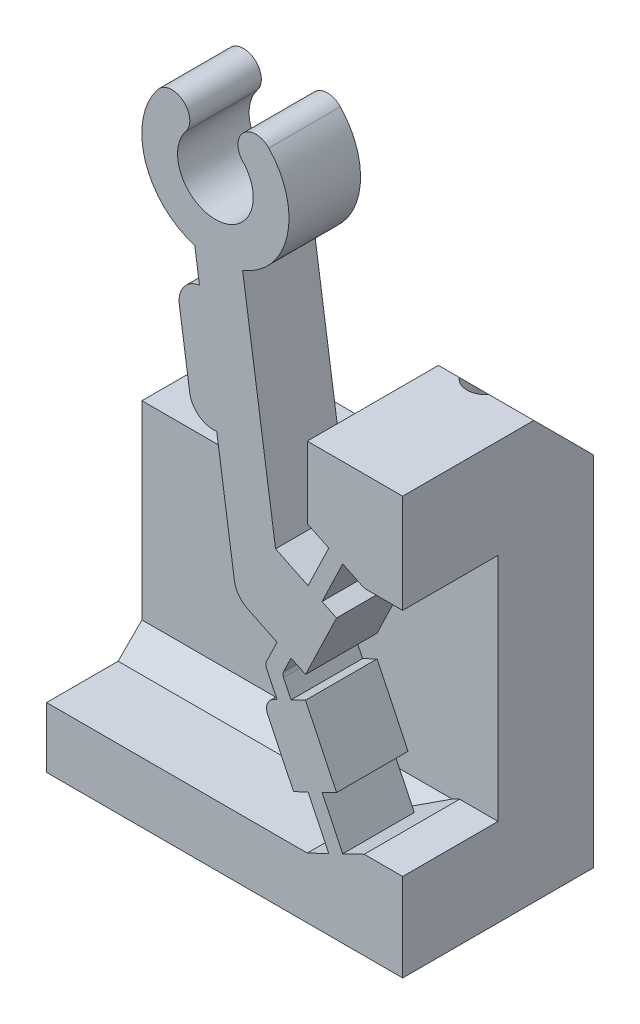
from build123d import *

# Parameters (mm, degrees)
BOSS_SWITCH_BODY_DEPTH        = 3
SKETCH1_W                     = 4
SKETCH1_H                     = 3.687347025
SKETCH1_H_2                   = 4.149321045
BOSS_FLANGE_WIDTH_DEPTH       = 5
BOSS_FLANGE_HEIGHT_REACH      = 35.973
SKETCH2_W                     = 4
SKETCH2_H                     = 4.149321045
SKETCH2_W_2                   = 8
SKETCH2_H_2                   = 2.53802598
SKETCH17_W                    = 14.933333866
SKETCH17_H                    = 4
BOSS_FLANGE_SUPPORT_DEPTH     = 10.812652975
CUT_WALL_GAP_DEPTH            = 1
SKETCH26_W                    = 10.933333866
SKETCH26_H                    = 6
CUT_CAM_SLOPE_CLEARANCE_DEPTH = 31.059873248
TAP_DRILL_FOR_M2X0_4_TAP1_D   = 1.6
M2_CLEARANCE_HOLE2_D          = 2.4
M2_CLEARANCE_HOLE2_DEPTH      = 6.5
CHAMFER_FLANGE_SUPPORT_3_SIZE = 1
SKETCH25_W                    = 5.60571229
SKETCH25_H                    = 17.5
CUT_BASE_REMOVAL_DEPTH        = 3
CHAMFER8_SIZE                 = 2.5
FILLET1_R                     = 1
FILLET2_R                     = 0.5


with BuildPart() as part:
    # Sketch-SwitchBossUp → Boss-Switch Body (new body)
    with BuildSketch(Plane.XY):
        with BuildLine():
            Line((-0.897289862, 21.27382814), (-0.700379438, 19.929528492))
            ThreePointArc((-0.700379438, 19.929528492), (-1.357570909, 19.537245674), (-1.544889614, 18.795155289))
            Line((-1.544889614, 18.795155289), (-1.110095072, 15.826830221))
            ThreePointArc((-1.110095072, 15.826830221), (-0.717812255, 15.169638751), (0.02427813, 14.982320046))
            Line((0.02427813, 14.982320046), (0.840131285, 9.412522958))
            Line((0.840131285, 9.412522958), (1.945259485, 8.880589721))
            Line((1.945259485, 8.880589721), (2.553471215, 8.587838134))
            Line((2.553471215, 8.587838134), (2.104108424, 7.654255765))
            ThreePointArc((2.104108424, 7.654255765), (2.079372028, 7.545829251), (2.104108424, 7.437402737))
            Line((2.104108424, 7.437402737), (2.553471215, 6.503820369))
            Line((2.553471215, 6.503820369), (1.945259485, 6.211068782))
            Line((1.945259485, 6.211068782), (3.246377649, 3.507905538))
            Line((3.246377649, 3.507905538), (3.854589379, 3.800657125))
            Line((3.854589379, 3.800657125), (4.722001489, 1.998548296))
            Line((4.722001489, 1.998548296), (3.820947074, 1.564842241))
            Line((3.820947074, 1.564842241), (3.820947074, -0.973183739))
            Line((3.820947074, -0.973183739), (5.277352178, -0.973183739))
            Line((5.277352178, -0.973183739), (13.426659364, -0.973183739))
            Line((13.426659364, -0.973183739), (13.426659364, 16.526816261))
            Line((13.426659364, 16.526816261), (7.114618425, 16.526816261))
            Line((7.114618425, 16.526816261), (3.820947074, 16.526816261))
            Line((3.820947074, 16.526816261), (3.820947074, 13.526816261))
            Line((3.820947074, 13.526816261), (4.722001489, 13.093110206))
            Line((4.722001489, 13.093110206), (3.854589379, 11.291001377))
            Line((3.854589379, 11.291001377), (2.490115752, 11.94776579))
            Line((2.490115752, 11.94776579), (1.110059725, 21.369353491))
            ThreePointArc((1.110059725, 21.369353491), (2.982945849, 23.574065074), (2.208754741, 26.361372687))
            ThreePointArc((2.208754741, 26.361372687), (1.148478545, 26.389910192), (1.119941041, 25.329633996))
            ThreePointArc((1.119941041, 25.329633996), (0.033089246, 22.651561394), (-1.270789677, 25.230944933))
            ThreePointArc((-1.270789677, 25.230944933), (-1.386617314, 26.285261754), (-2.440934135, 26.169434117))
            ThreePointArc((-2.440934135, 26.169434117), (-2.976976555, 23.309245483), (-0.897289862, 21.27382814))
        make_face()
        with BuildLine():
            Line((6.208741273, 2.714163286), (10.695012416, 2.714163286))
            Line((10.695012416, 2.714163286), (10.695012416, 12.377495216))
            Line((10.695012416, 12.377495216), (6.208741273, 12.377495216))
            Line((6.208741273, 12.377495216), (5.307686858, 12.811201271))
            Line((5.307686858, 12.811201271), (4.440274749, 11.009092442))
            Line((4.440274749, 11.009092442), (5.048486478, 10.716340855))
            Line((5.048486478, 10.716340855), (3.747368314, 8.013177611))
            Line((3.747368314, 8.013177611), (3.139156584, 8.305929198))
            Line((3.139156584, 8.305929198), (2.825485502, 7.654255765))
            ThreePointArc((2.825485502, 7.654255765), (2.800749105, 7.545829251), (2.825485502, 7.437402737))
            Line((2.825485502, 7.437402737), (3.139156584, 6.785729304))
            Line((3.139156584, 6.785729304), (3.747368314, 7.078480891))
            Line((3.747368314, 7.078480891), (5.048486478, 4.375317648))
            Line((5.048486478, 4.375317648), (4.440274749, 4.082566061))
            Line((4.440274749, 4.082566061), (5.307686858, 2.280457231))
            Line((5.307686858, 2.280457231), (6.208741273, 2.714163286))
        make_face(mode=Mode.SUBTRACT)
    extrude(amount=BOSS_SWITCH_BODY_DEPTH)

    # Sketch1 → Boss-Flange Width (add)
    with BuildSketch(Plane(origin=(0, 0, 0), x_dir=(-1, 0, 0), z_dir=(0, 0, -1))):
        with Locations((-5.820947074, 0.870489774)):
            Rectangle(SKETCH1_W, SKETCH1_H)
        with Locations((-5.820947074, 14.452155739)):
            Rectangle(SKETCH1_W, SKETCH1_H_2)
    extrude(amount=BOSS_FLANGE_WIDTH_DEPTH)

    # Sketch2 → Boss-Flange Height (add, up to next)
    with BuildSketch(Plane(origin=(-7.112386792, 0, 0), x_dir=(0, 0, -1), z_dir=(1, 0, 0)), mode=Mode.PRIVATE) as boss_flange_height_sk1:
        with Locations((3, 14.452155739)):
            Rectangle(SKETCH2_W, SKETCH2_H)
    boss_flange_height_tool1 = extrude(boss_flange_height_sk1.sketch, amount=BOSS_FLANGE_HEIGHT_REACH, mode=Mode.PRIVATE) - part.part
    # Sketch2 → Boss-Flange Height (add, up to next)
    with BuildSketch(Plane(origin=(-7.112386792, 0, 0), x_dir=(0, 0, -1), z_dir=(1, 0, 0)), mode=Mode.PRIVATE) as boss_flange_height_sk2:
        with Locations((1, 0.295829251)):
            Rectangle(SKETCH2_W_2, SKETCH2_H_2)
    boss_flange_height_tool2 = extrude(boss_flange_height_sk2.sketch, amount=BOSS_FLANGE_HEIGHT_REACH, mode=Mode.PRIVATE) - part.part
    add(boss_flange_height_tool1.solids().sort_by_distance((-7.112387, 14.452156, -3))[0])
    add(boss_flange_height_tool2.solids().sort_by_distance((-7.112387, 0.295829, -1))[0])

    # Sketch17 → Boss-Flange Support (add)
    with BuildSketch(Plane.XZ.offset(-1.564842241)):
        with Locations((0.354280141, -3)):
            Rectangle(SKETCH17_W, SKETCH17_H)
    extrude(amount=-BOSS_FLANGE_SUPPORT_DEPTH)

    # Sketch27 → Cut-Wall Gap (cut)
    with BuildSketch(Plane.XY):
        Polygon((3.820947074, 13.526816261), (6.208741273, 12.377495216), (3.820947074, 12.377495216), align=None)
        Polygon((6.208741273, 2.714163286), (3.820947074, 2.714163286), (3.820947074, 1.564842241), align=None)
    extrude(amount=-CUT_WALL_GAP_DEPTH, mode=Mode.SUBTRACT)

    # Sketch26 → Cut-Cam Slope Clearance (cut, through all)
    with BuildSketch(Plane.XY.offset(-1)):
        with Locations((-1.645719859, 13.526816261)):
            Rectangle(SKETCH26_W, SKETCH26_H)
    extrude(amount=-CUT_CAM_SLOPE_CLEARANCE_DEPTH, mode=Mode.SUBTRACT)

    # Tap Drill for M2x0.4 Tap1 (through all)
    with Locations(Plane(origin=(0, -0.973183739, 0), x_dir=(-1, 0, 0), z_dir=(0, -1, 0))):
        with Locations((4.112386792, 3), (-5.320947074, 3)):
            Hole(TAP_DRILL_FOR_M2X0_4_TAP1_D / 2)

    # M2 Clearance Hole2
    with Locations(Plane.XZ.offset(0.973183739)):
        with Locations((-4.112386792, -3), (5.320947074, -3)):
            Hole(M2_CLEARANCE_HOLE2_D / 2, depth=M2_CLEARANCE_HOLE2_DEPTH)

    # Chamfer-Flange Support 3
    chamfer_flange_support_3_edges = [part.edges().sort_by_distance(p)[0] for p in [
        (-1.645719859, 1.564842241, -1),
    ]]
    chamfer(chamfer_flange_support_3_edges, length=CHAMFER_FLANGE_SUPPORT_3_SIZE)

    # Sketch25 → Cut-Base Removal (cut)
    with BuildSketch(Plane.XY.offset(3)):
        with Locations((10.623803219, 7.776816261)):
            Rectangle(SKETCH25_W, SKETCH25_H)
    extrude(amount=-CUT_BASE_REMOVAL_DEPTH, mode=Mode.SUBTRACT)

    # Chamfer8
    # the kernel refuses this chamfer: 2.5 mm, written as the material it takes off along each edge
    with BuildSketch(Plane(origin=(14.250154544, 16.526816261, -5), x_dir=(0, 0.027495876610586317, 0.9996219169112968), z_dir=(-1, 0, 0))) as chamfer8_piece_1:
        Polygon((CHAMFER8_SIZE * 0.999621916911, -CHAMFER8_SIZE * 0.0274958766106), (-CHAMFER8_SIZE * 0.0274958766106, -CHAMFER8_SIZE * 0.999621916911), (0, 0), align=None)
    extrude(amount=16.85841494, mode=Mode.SUBTRACT)

    # Fillet1
    fillet1_edges = [part.edges().sort_by_distance(p)[0] for p in [
        (0.840131285, 9.412522958, 1.5),
    ]]
    fillet(fillet1_edges, radius=FILLET1_R)

    # Fillet2
    fillet2_edges = [part.edges().sort_by_distance(p)[0] for p in [
        (1.945259485, 6.211068782, 1.5),
    ]]
    fillet(fillet2_edges, radius=FILLET2_R)


solid = part.part
